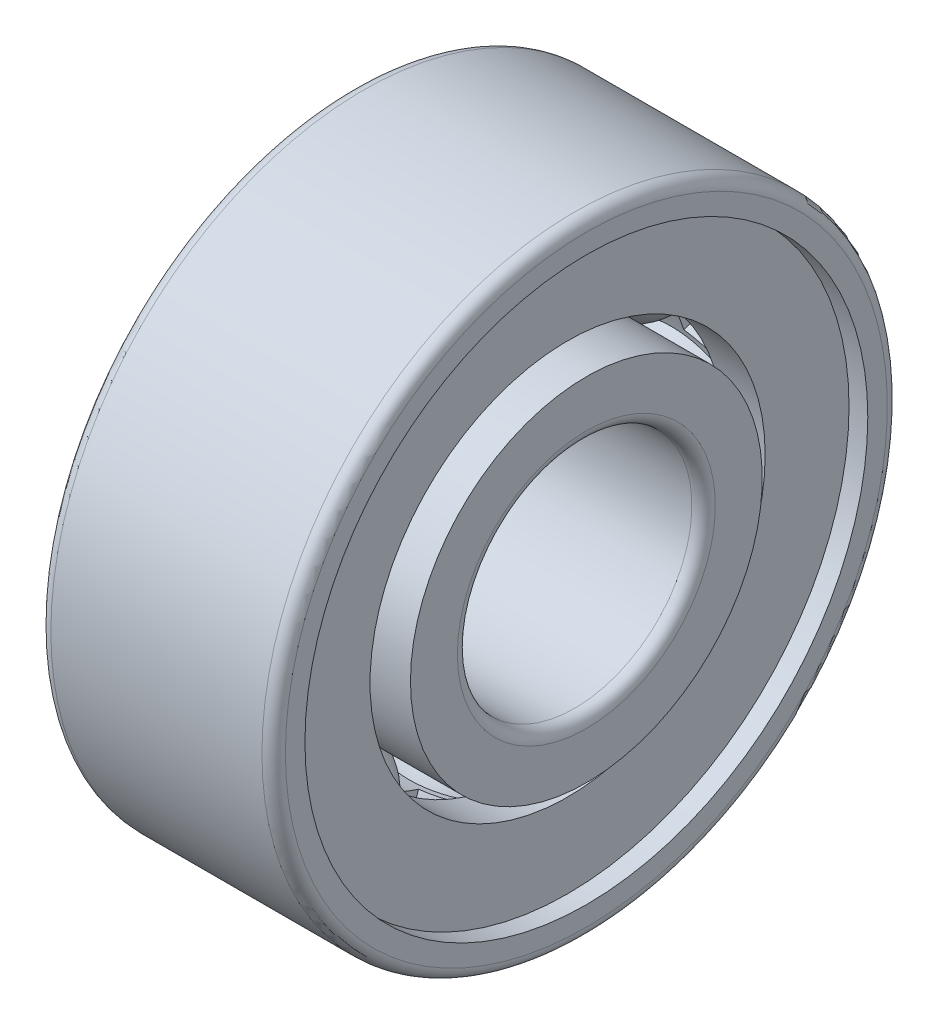
from build123d import *
from build123d.topology import SkipClean

# Parameters (mm, degrees)
SKETCH_2_W               = 0.3696
SKETCH_2_H               = 0.462
PATTERN_CIRCULAR_1_COUNT = 8
SKETCH_4_W               = 1.848
SKETCH_4_H               = 0.924
SKETCH_5_W               = 1.848
SKETCH_5_H               = 0.924
PATTERN_CIRCULAR_2_COUNT = 8
SKETCH_10_W              = 0.535202
SKETCH_10_H              = 0.8728
SKETCH_11_R              = 4
CUT_EXTRUDE_1_DEPTH      = 10


with BuildPart() as part:
    # 草图2 → Revolve 288 (revolve)
    with BuildSketch(Plane.XY):
        with Locations((0, 2.925)):
            Rectangle(SKETCH_2_W, SKETCH_2_H)
    revolve(axis=Axis((-12.42061, 0, 0), (1, 0, 0)))

    # 草图3 → 凸台-旋转1 (revolve)
    with BuildSketch(Plane.XY):
        with BuildLine():
            Line((-0.924, 2.925), (0.924, 2.925))
            ThreePointArc((0.924, 2.925), (0, 2.001), (-0.924, 2.925))
        make_face()
    revolve_1 = revolve(axis=Axis((-5.568094, 2.925, 0), (1, 0, 0)))

    # 阵列(圆周)1: 凸台-旋转1 ×8 about axis
    pattern_circular_1_axis = Axis((-12.42061, 0, 0), (1, 0, 0))
    for i in range(1, PATTERN_CIRCULAR_1_COUNT):
        add(revolve_1.rotate(pattern_circular_1_axis, i * 360 / PATTERN_CIRCULAR_1_COUNT))

    # 草图4 → 切除-旋转1 (revolve, cut)
    with BuildSketch(Plane.XY):
        with Locations((0, 3.618)):
            Rectangle(SKETCH_4_W, SKETCH_4_H)
    revolve(axis=Axis((0, 0, 0), (1, 0, 0)), mode=Mode.SUBTRACT)

    # 草图5 → 切除-旋转2 (revolve, cut)
    with BuildSketch(Plane.XY):
        with Locations((0, 2.232)):
            Rectangle(SKETCH_5_W, SKETCH_5_H)
    revolve(axis=Axis((0, 0, 0), (1, 0, 0)), mode=Mode.SUBTRACT)

    # 草图6 → 凸台-旋转2 (revolve)
    with BuildSketch(Plane.XY):
        with BuildLine():
            Line((-0.84, 2.925), (0.84, 2.925))
            ThreePointArc((0.84, 2.925), (0, 2.085), (-0.84, 2.925))
        make_face()
    revolve_2 = revolve(axis=Axis((-5.568094, 2.925, 0), (1, 0, 0)))

    # 阵列(圆周)2: 凸台-旋转2 ×8 about axis
    pattern_circular_2_axis = Axis((-12.42061, 0, 0), (1, 0, 0))
    for i in range(1, PATTERN_CIRCULAR_2_COUNT):
        add(revolve_2.rotate(pattern_circular_2_axis, i * 360 / PATTERN_CIRCULAR_2_COUNT))

    # 草图7 → 凸台-旋转3 (revolve)
    with BuildSketch(Plane.XY):
        with BuildLine():
            Line((-1.35, 4), (1.35, 4))
            ThreePointArc((1.35, 4), (1.456066, 3.956066), (1.5, 3.85))
            Line((1.5, 3.85), (1.5, 3.6))
            Line((1.5, 3.6), (1.26, 3.6))
            Line((1.26, 3.6), (1.26, 3.4))
            Line((1.26, 3.4), (0.724798, 3.4))
            Line((0.724798, 3.4), (0.724798, 3.6))
            Line((0.724798, 3.6), (0.482986, 3.6))
            ThreePointArc((0.482986, 3.6), (0, 3.755), (-0.482986, 3.6))
            Line((-0.482986, 3.6), (-1.5, 3.6))
            Line((-1.5, 3.6), (-1.5, 3.85))
            ThreePointArc((-1.5, 3.85), (-1.456066, 3.956066), (-1.35, 4))
        make_face()
    revolve(axis=Axis((0, 0, 0), (1, 0, 0)))

    # 草图8 → 凸台-旋转4 (revolve)
    with BuildSketch(Plane.XY):
        with BuildLine():
            Line((-1.5, 2.25), (-0.482986, 2.25))
            ThreePointArc((-0.482986, 2.25), (0, 2.095), (0.482986, 2.25))
            Line((0.482986, 2.25), (1.5, 2.25))
            Line((1.5, 2.25), (1.5, 1.65))
            ThreePointArc((1.5, 1.65), (1.456066, 1.543934), (1.35, 1.5))
            Line((1.35, 1.5), (-1.35, 1.5))
            ThreePointArc((-1.35, 1.5), (-1.456066, 1.543934), (-1.5, 1.65))
            Line((-1.5, 1.65), (-1.5, 2.25))
        make_face()
    revolve(axis=Axis((-12.42061, 0, 0), (1, 0, 0)))

    # 草图10 → 凸台-旋转5 (revolve)
    with BuildSketch(Plane.XY):
        with Locations((0.992399, 2.9636)):
            Rectangle(SKETCH_10_W, SKETCH_10_H)
    revolve(axis=Axis((0, 0, 0), (-1, 0, 0)))

    # 草图11 → 切除-拉伸1 (cut)
    with BuildSketch(Plane(origin=(0, 0, 0), x_dir=(0, 0, -1), z_dir=(1, 0, 0))):
        Circle(SKETCH_11_R)
    extrude(amount=-CUT_EXTRUDE_1_DEPTH, mode=Mode.SUBTRACT)

    # 镜向所有1: part across plane


with BuildPart() as part_1:
    with SkipClean():  # the faces are left unmerged after this step: merging them gives an invalid solid
        add(part.part)
        add(part.part.mirror(Plane(origin=(0, 0, 0), x_dir=(0, 0, 1), z_dir=(1, 0, 0))))


solid = part_1.part
